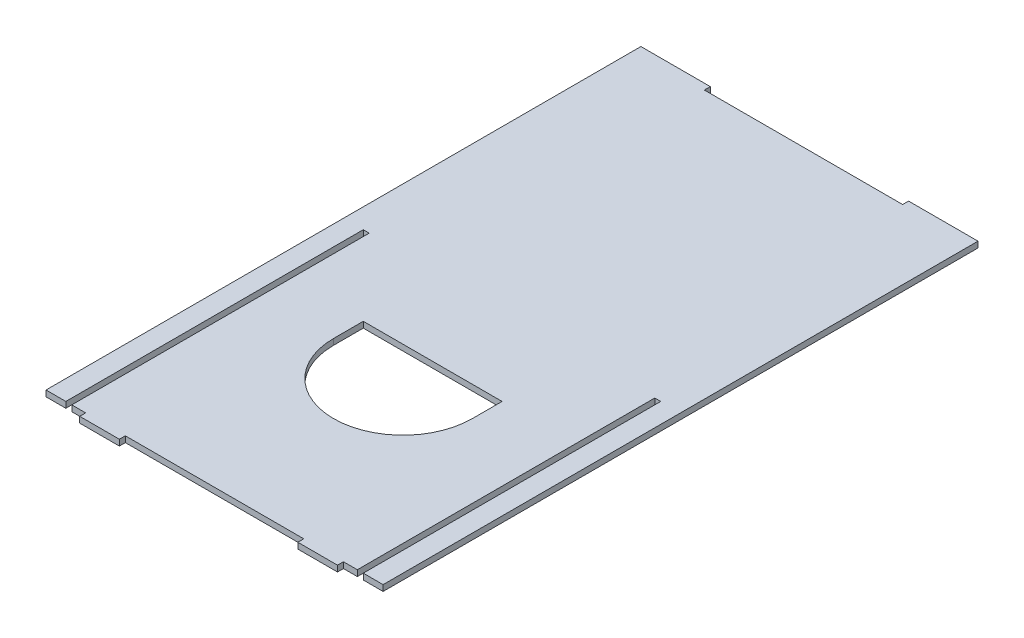
from build123d import *

# Parameters (mm, degrees)
BOSS_EXTRUDE1_DEPTH = 6
SKETCH2_W           = 6
SKETCH2_H           = 300
CUT_EXTRUDE1_DEPTH  = 6
LPATTERN1_COUNT     = 2
LPATTERN1_PITCH     = 294
SKETCH3_W           = 200
SKETCH3_H           = 6
CUT_EXTRUDE2_DEPTH  = 6


with BuildPart() as part:
    # Sketch1 → Boss-Extrude1 (new body)
    with BuildSketch(Plane(origin=(0, 0, 0), x_dir=(1, 0, 0), z_dir=(0, 1, 0))):
        Polygon((300, 0), (300, -6), (260, -6), (260, 0), (80, 0), (80, -6), (40, -6), (40, 0), (0, 0), (0, 600), (340, 600), (340, 0), align=None)
    extrude(amount=BOSS_EXTRUDE1_DEPTH)

    # Sketch2 → Cut-Extrude1 (cut)
    with BuildSketch(Plane(origin=(0, 6, 0), x_dir=(1, 0, 0), z_dir=(0, 1, 0))):
        with Locations((23, 150)):
            Rectangle(SKETCH2_W, SKETCH2_H)
    cut_extrude1 = extrude(amount=-CUT_EXTRUDE1_DEPTH, mode=Mode.SUBTRACT)

    # LPattern1: Cut-Extrude1 ×2
    with Locations(*[(i * LPATTERN1_PITCH, 0, 0) for i in range(1, LPATTERN1_COUNT)]):
        add(cut_extrude1, mode=Mode.SUBTRACT)

    # Sketch3 → Cut-Extrude2 (cut)
    with BuildSketch(Plane(origin=(0, 6, 0), x_dir=(1, 0, 0), z_dir=(0, 1, 0))):
        with BuildLine():
            Line((100, 190), (100, 220))
            Line((100, 220), (240, 220))
            Line((240, 220), (240, 190))
            ThreePointArc((240, 190), (170, 120), (100, 190))
        make_face()
        with Locations((170, 597)):
            Rectangle(SKETCH3_W, SKETCH3_H)
    extrude(amount=-CUT_EXTRUDE2_DEPTH, mode=Mode.SUBTRACT)


solid = part.part
